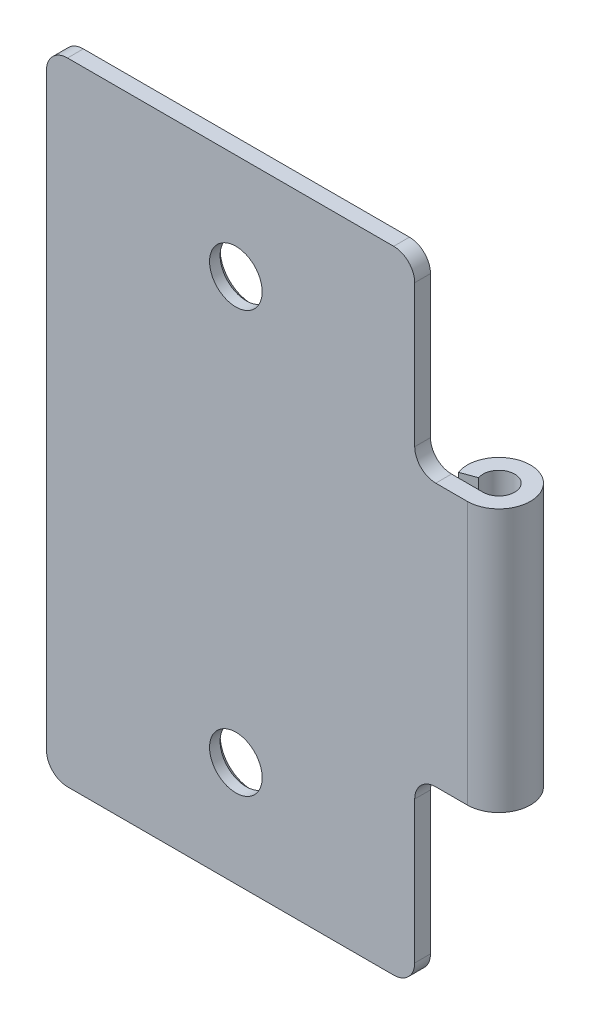
from build123d import *

# Parameters (mm, degrees)
BASE_FLANGE1_DEPTH                             = 3
CUT_EXTRUDE1_DEPTH                             = 11.75046698
CUT_EXTRUDE1_DEPTH_BACK                        = 11.75046698
SKETCH10_W                                     = 0.8
SKETCH10_H                                     = 1.75
FILLET1_R                                      = 0.2
CSK_FOR_M3_FLAT_HEAD_MACHINE_SCREW1_AT_2_COUNT = 2
CSK_FOR_M3_FLAT_HEAD_MACHINE_SCREW1_AT_2_PITCH = 4


# Sheet-metal steps are written as plain solids
with BuildPart() as part:
    # Sketch5 → Base-Flange1 (new, symmetric)
    with BuildSketch(Plane(origin=(0, 0, 0), x_dir=(1, 0, 0), z_dir=(0, 1, 0))):
        with BuildLine():
            ThreePointArc((9.872631336, 0.098696979), (10.099621695, 0.272872807), (10.013585229, 0))
            Line((10.013585229, 0), (6.013585229, 0))
            Line((6.013585229, 0), (6.013585229, -0.15))
            Line((6.013585229, -0.15), (10.013585229, -0.15))
            ThreePointArc((10.013585229, -0.15), (10.18565816, 0.395745613), (9.731677443, 0.047393957))
            Line((9.731677443, 0.047393957), (9.872631336, 0.098696979))
        make_face()
    extrude(amount=BASE_FLANGE1_DEPTH, both=True)

    # Sketch10 → Cut-Extrude1 (cut, two sides: drawn at the far end of the back side and taken through both)
    with BuildSketch(Plane(origin=(0, 0, 0), x_dir=(-1, 0, 0), z_dir=(0, 0, -1)).offset(-CUT_EXTRUDE1_DEPTH_BACK)):
        with Locations((-9.913585229, 2.125)):
            Rectangle(SKETCH10_W, SKETCH10_H)
        with Locations((-9.913585229, -2.125)):
            Rectangle(SKETCH10_W, SKETCH10_H)
    extrude(amount=CUT_EXTRUDE1_DEPTH + CUT_EXTRUDE1_DEPTH_BACK, mode=Mode.SUBTRACT)

    # Fillet1
    fillet1_edges = [part.edges().sort_by_distance(p)[0] for p in [
        (6.013585229, 3, 0.075),
        (9.513585229, 1.25, 0.075),
        (9.513585229, 3, 0.075),
        (6.013585229, -3, 0.075),
        (9.513585229, -3, 0.075),
        (9.513585229, -1.25, 0.075),
    ]]
    fillet(fillet1_edges, radius=FILLET1_R)

    # Sketch13 → CSK for M3 Flat Head Machine Screw1 (revolve, cut)
    with BuildSketch(Plane(origin=(7.813585229, 2, 0), x_dir=(0, 1, 0), z_dir=(1, 0, 0))):
        Polygon((0, 0), (0, 0.15), (0.25, 0.15), (0.25, 0.05), (0.3, 0), align=None)
    csk_for_m3_flat_head_machine_screw1 = revolve(axis=Axis((7.813585229, 2, -6.35), (0, 0, 1)), mode=Mode.SUBTRACT)

    # CSK for M3 Flat Head Machine Screw1 at 2: CSK for M3 Flat Head Machine Screw1 ×2
    with Locations(*[(0, -i * CSK_FOR_M3_FLAT_HEAD_MACHINE_SCREW1_AT_2_PITCH, 0) for i in range(1, CSK_FOR_M3_FLAT_HEAD_MACHINE_SCREW1_AT_2_COUNT)]):
        add(csk_for_m3_flat_head_machine_screw1, mode=Mode.SUBTRACT)


solid = part.part
